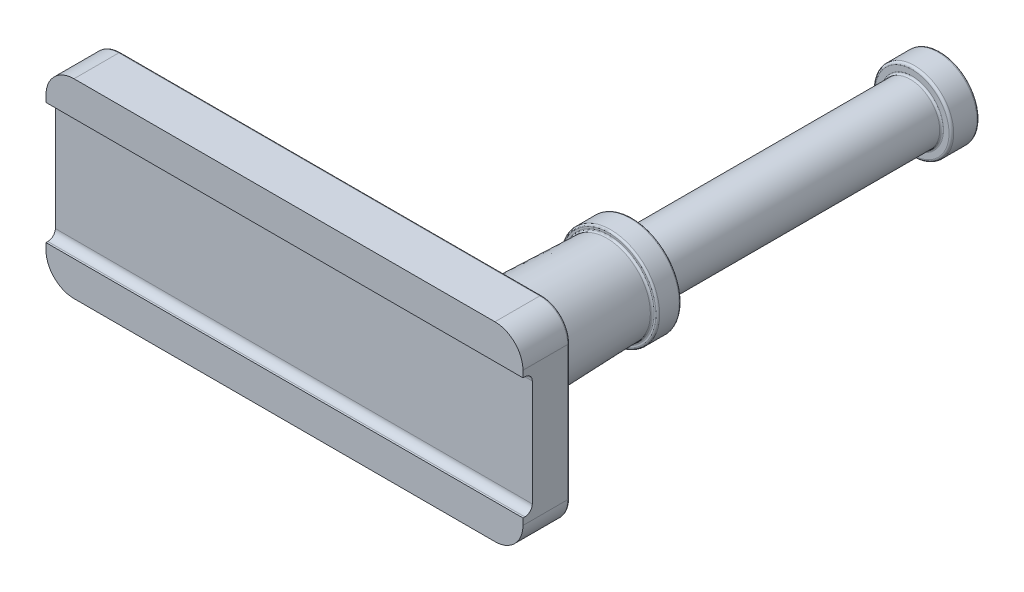
from build123d import *

# Parameters (mm, degrees)
SKETCH1_W      = 2555
SKETCH1_H      = 1020
EXTRUDE1_DEPTH = 250
FILLET1_R      = 150
FILLET2_R      = 10
EXTRUDE2_DEPTH = 150
FILLET3_R      = 20
EXTRUDE3_DEPTH = 50
FILLET4_R      = 10
EXTRUDE4_DEPTH = 3611.834391107
SCALE1_SCALE   = 0.8
FILLET5_R      = 10


with BuildPart() as part:
    # Sketch1 → Extrude1 (new body)
    with BuildSketch(Plane.XY):
        Rectangle(SKETCH1_W, SKETCH1_H)
    extrude(amount=EXTRUDE1_DEPTH)

    # Fillet1
    fillet1_edges = [part.edges().sort_by_distance(p)[0] for p in [
        (1277.5, -510, 125),
        (-1277.5, -510, 125),
        (1277.5, 510, 125),
        (-1277.5, 510, 125),
    ]]
    fillet(fillet1_edges, radius=FILLET1_R)

    # Sketch4 → Revolve1 (revolve)
    with BuildSketch(Plane(origin=(762.5, 0, 0), x_dir=(0, 0, -1), z_dir=(1, 0, 0))):
        Polygon((0, 0), (2500, 0), (2500, 210), (2350, 210), (2350, 157.5), (850, 157.5), (850, 262.5), (725, 262.5), (725, 232.5), (80, 255.023896322), (80, 300), (0, 300), align=None)
    revolve(axis=Axis((762.5, 0, -2500), (0, 0, -1)))

    # Fillet2
    fillet2_edges = [part.edges().sort_by_distance(p)[0] for p in [
        (762.5, -157.5, -2350),
        (762.5, -157.5, -850),
        (762.5, -232.5, -725),
        (762.5, -262.5, -725),
        (762.5, -262.5, -850),
        (762.5, -255.023896322, -80),
        (762.5, -300, -80),
        (762.5, -300, 0),
    ]]
    fillet(fillet2_edges, radius=FILLET2_R)

    # Sketch5 → Extrude2 (cut)
    with BuildSketch(Plane(origin=(0, 0, 0), x_dir=(-1, 0, 0), z_dir=(0, 0, -1))):
        with BuildLine():
            Line((1127.5, 395), (1127.5, 315))
            Line((1127.5, 315), (1072.5, 260))
            Line((1072.5, 260), (-290, 260))
            Line((-290, 260), (-302.5, 272.5))
            Line((-302.5, 272.5), (-382.5, 272.5))
            Line((-382.5, 272.5), (-382.5, 222.5))
            Line((-382.5, 222.5), (-302.5, 222.5))
            Line((-302.5, 222.5), (-290, 235))
            Line((-290, 235), (1072.5, 235))
            Line((1072.5, 235), (1072.5, 95))
            Line((1072.5, 95), (-290, 95))
            Line((-290, 95), (-302.5, 107.5))
            Line((-302.5, 107.5), (-382.5, 107.5))
            Line((-382.5, 107.5), (-382.5, 57.5))
            Line((-382.5, 57.5), (-302.5, 57.5))
            Line((-302.5, 57.5), (-290, 70))
            Line((-290, 70), (1072.5, 70))
            Line((1072.5, 70), (1072.5, -70))
            Line((1072.5, -70), (-290, -70))
            Line((-290, -70), (-302.5, -57.5))
            Line((-302.5, -57.5), (-382.5, -57.5))
            Line((-382.5, -57.5), (-382.5, -107.5))
            Line((-382.5, -107.5), (-302.5, -107.5))
            Line((-302.5, -107.5), (-290, -95))
            Line((-290, -95), (1072.5, -95))
            Line((1072.5, -95), (1072.5, -235))
            Line((1072.5, -235), (-290, -235))
            Line((-290, -235), (-302.5, -222.5))
            Line((-302.5, -222.5), (-382.5, -222.5))
            Line((-382.5, -222.5), (-382.5, -272.5))
            Line((-382.5, -272.5), (-302.5, -272.5))
            Line((-302.5, -272.5), (-290, -260))
            Line((-290, -260), (1072.5, -260))
            Line((1072.5, -260), (1127.5, -315))
            Line((1127.5, -315), (1127.5, -395))
            Line((1127.5, -395), (-292.361218113, -395))
            ThreePointArc((-292.361218113, -395), (-321.606100707, -385.555355283), (-339.802682264, -360.789473684))
            ThreePointArc((-339.802682264, -360.789473684), (-418.999819754, -348.679605666), (-382.5, -420))
            Line((-382.5, -420), (1127.5, -420))
            ThreePointArc((1127.5, -420), (1169.926406871, -402.426406871), (1187.5, -360))
            Line((1187.5, -360), (1187.5, 360))
            ThreePointArc((1187.5, 360), (1169.926406871, 402.426406871), (1127.5, 420))
            Line((1127.5, 420), (-382.5, 420))
            ThreePointArc((-382.5, 420), (-418.999819754, 348.679605666), (-339.802682264, 360.789473684))
            ThreePointArc((-339.802682264, 360.789473684), (-321.606100707, 385.555355283), (-292.361218113, 395))
            Line((-292.361218113, 395), (1127.5, 395))
        make_face()
    extrude(amount=-EXTRUDE2_DEPTH, mode=Mode.SUBTRACT)

    # Fillet3
    fillet3_edges = [part.edges().sort_by_distance(p)[0] for p in [
        (-1127.5, 315, 75),
        (-1072.5, 260, 75),
        (-1072.5, 235, 75),
        (-1072.5, 95, 75),
        (-1072.5, 70, 75),
        (-1072.5, -70, 75),
        (-1072.5, -95, 75),
        (-1072.5, -235, 75),
        (-1072.5, -260, 75),
        (-1127.5, -315, 75),
        (-1127.5, 395, 75),
        (-1127.5, -395, 75),
    ]]
    fillet(fillet3_edges, radius=FILLET3_R)

    # Sketch7 → Extrude3 (cut)
    with BuildSketch(Plane(origin=(0, 0, 0), x_dir=(-1, 0, 0), z_dir=(0, 0, -1))):
        with BuildLine():
            Line((-557.5, -420), (-1127.5, -420))
            ThreePointArc((-1127.5, -420), (-1169.926406871, -402.426406871), (-1187.5, -360))
            Line((-1187.5, -360), (-1187.5, 360))
            ThreePointArc((-1187.5, 360), (-1169.926406871, 402.426406871), (-1127.5, 420))
            Line((-1127.5, 420), (-557.5, 420))
            ThreePointArc((-557.5, 420), (-529.215728753, 408.284271247), (-517.5, 380))
            Line((-517.5, 380), (-517.5, 337.638860323))
            ThreePointArc((-517.5, 337.638860323), (-537.883422149, 302.779286696), (-578.259493671, 303.447583328))
            ThreePointArc((-578.259493671, 303.447583328), (-1117.5, 0), (-578.259493671, -303.447583328))
            ThreePointArc((-578.259493671, -303.447583328), (-537.883422149, -302.779286696), (-517.5, -337.638860323))
            Line((-517.5, -337.638860323), (-517.5, -380))
            ThreePointArc((-517.5, -380), (-529.215728753, -408.284271247), (-557.5, -420))
        make_face()
    extrude(amount=-EXTRUDE3_DEPTH, mode=Mode.SUBTRACT)

    # Fillet4
    fillet4_edges = [part.edges().sort_by_distance(p)[0] for p in [
        (-1125.97759065, 315.6306026, 0),
        (-1100, 287.5, 0),
        (-1071.8693974, 261.52240935, 0),
        (-387.107864376, 260, 0),
        (296.25, 266.25, 0),
        (342.5, 272.5, 0),
        (382.5, 247.5, 0),
        (342.5, 222.5, 0),
        (296.25, 228.75, 0),
        (-381.25, 235, 0),
        (-1066.642135624, 229.142135624, 0),
        (-1072.5, 165, 0),
        (-1066.642135624, 100.857864376, 0),
        (-381.25, 95, 0),
        (296.25, 101.25, 0),
        (342.5, 107.5, 0),
        (382.5, 82.5, 0),
        (342.5, 57.5, 0),
        (296.25, 63.75, 0),
        (-381.25, 70, 0),
        (-1066.642135624, 64.142135624, 0),
        (-1072.5, 0, 0),
        (-1066.642135624, -64.142135624, 0),
        (-381.25, -70, 0),
        (296.25, -63.75, 0),
        (342.5, -57.5, 0),
        (382.5, -82.5, 0),
        (342.5, -107.5, 0),
        (296.25, -101.25, 0),
        (-381.25, -95, 0),
        (-1066.642135624, -100.857864376, 0),
        (-1072.5, -165, 0),
        (-1066.642135624, -229.142135624, 0),
        (-381.25, -235, 0),
        (296.25, -228.75, 0),
        (342.5, -222.5, 0),
        (382.5, -247.5, 0),
        (342.5, -272.5, 0),
        (296.25, -266.25, 0),
        (-387.107864376, -260, 0),
        (-1071.8693974, -261.52240935, 0),
        (-1100, -287.5, 0),
        (-1125.97759065, -315.6306026, 0),
        (-1127.5, -349.142135624, 0),
        (-1121.642135624, -389.142135624, 0),
        (-407.569390943, -395, 0),
        (321.606100707, -385.555355283, 0),
        (418.999819754, -348.679605666, 0),
        (-372.5, -420, 0),
        (-1169.926406871, -402.426406871, 0),
        (-1187.5, 0, 0),
        (-1169.926406871, 402.426406871, 0),
        (-372.5, 420, 0),
        (418.999819754, 348.679605666, 0),
        (321.606100707, 385.555355283, 0),
        (-407.569390943, 395, 0),
        (-1121.642135624, 389.142135624, 0),
        (-1127.5, 349.142135624, 0),
        (1233.566017178, 466.066017178, 0),
        (0, 510, 0),
        (-1233.566017178, 466.066017178, 0),
        (-1277.5, 0, 0),
        (-1233.566017178, -466.066017178, 0),
        (0, -510, 0),
        (1233.566017178, -466.066017178, 0),
        (1277.5, 0, 0),
        (842.5, -420, 0),
        (529.215728753, -408.284271247, 0),
        (517.5, -358.819430161, 0),
        (537.883422149, -302.779286696, 0),
        (1117.5, 0, 0),
        (537.883422149, 302.779286696, 0),
        (517.5, 358.819430161, 0),
        (529.215728753, 408.284271247, 0),
        (842.5, 420, 0),
        (1169.926406871, 402.426406871, 0),
        (1187.5, 0, 0),
        (1169.926406871, -402.426406871, 0),
        (1187.5, 0, 50),
        (1169.926406871, 402.426406871, 50),
        (842.5, 420, 50),
        (529.215728753, 408.284271247, 50),
        (517.5, 358.819430161, 50),
        (537.883422149, 302.779286696, 50),
        (1117.5, 0, 50),
        (537.883422149, -302.779286696, 50),
        (517.5, -358.819430161, 50),
        (529.215728753, -408.284271247, 50),
        (842.5, -420, 50),
        (1169.926406871, -402.426406871, 50),
    ]]
    fillet(fillet4_edges, radius=FILLET4_R)

    # Sketch8 → Extrude4 (cut, through all)
    with BuildSketch(Plane(origin=(1277.5, 0, 0), x_dir=(0, 0, -1), z_dir=(1, 0, 0))):
        with BuildLine():
            Line((-250, 325), (-240, 325))
            ThreePointArc((-240, 325), (-211.715728753, 313.284271247), (-200, 285))
            Line((-200, 285), (-200, -285))
            ThreePointArc((-200, -285), (-211.715728753, -313.284271247), (-240, -325))
            Line((-240, -325), (-250, -325))
            Line((-250, -325), (-250, 325))
        make_face()
    extrude(amount=-EXTRUDE4_DEPTH, mode=Mode.SUBTRACT)


with BuildPart() as part_1:
    # Scale1: scaled about (306.70321942, 0, -305.001599753)
    add(part.part.scale(SCALE1_SCALE).moved(Location((61.340643884, 0, -61.000319951))))

    # Fillet5
    fillet5_edges = [part_1.edges().sort_by_distance(p)[0] for p in [
        (671.340643884, -168, -1941.000319951),
        (671.340643884, -168, -2061.000319951),
    ]]
    fillet(fillet5_edges, radius=FILLET5_R)


solid = part_1.part
